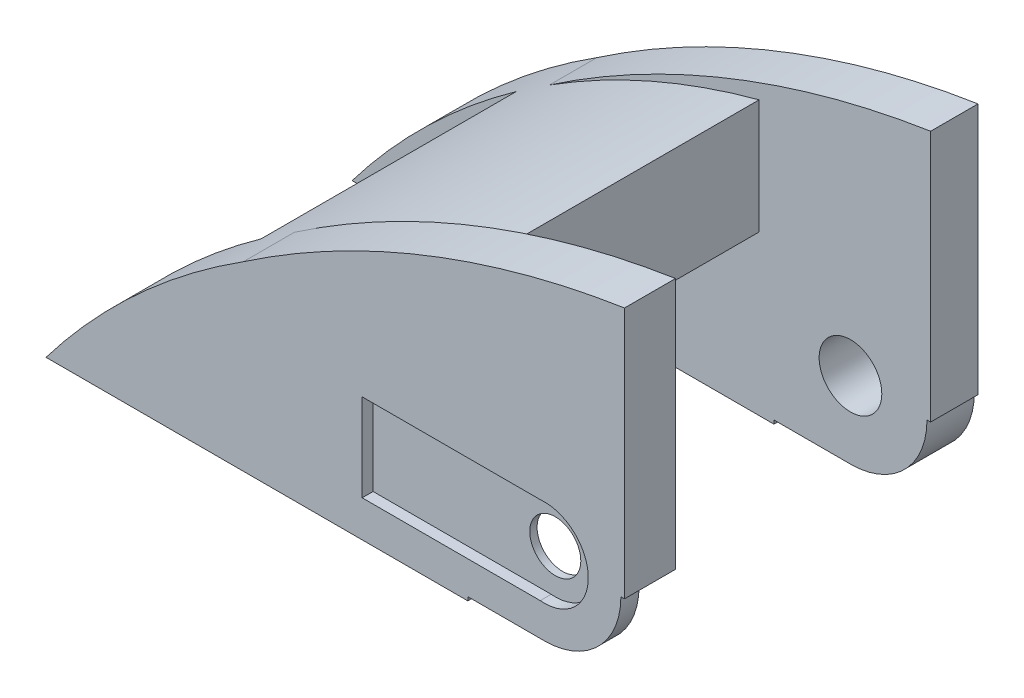
from build123d import *
from build123d.topology import SkipClean

# Parameters (mm, degrees)
SKETCH1_R                 = 9.5
BOSS_EXTRUDE1_DEPTH       = 48
SKETCH2_W                 = 34
SKETCH2_H                 = 30
CUT_EXTRUDE1_DEPTH        = 62.481704596
BOSS_EXTRUDE2_START       = -2.5
SKETCH3_R                 = 9.5
SKETCH3_R_2               = 2.4
BOSS_EXTRUDE2_DEPTH       = 2.5
SKETCH4_R                 = 9.5
SKETCH4_R_2               = 4.2
BOSS_EXTRUDE3_DEPTH       = 7
SKETCH5_R                 = 4.2
BOSS_EXTRUDE4_DEPTH       = 11
BOSS_EXTRUDE5_DEPTH       = 48
CUT_EXTRUDE2_START        = -48
CUT_EXTRUDE2_OUTLINE_R    = 2.65
CUT_EXTRUDE2_DEPTH        = 48
CUT_EXTRUDE3_START        = -4.5
SKETCH8_R                 = 9.5
CUT_EXTRUDE3_DEPTH        = 4.5
SKETCH9_R                 = 6.067807638
CUT_EXTRUDE4_DEPTH        = 4.5
SKETCH10_R                = 9.5
BOSS_EXTRUDE6_DEPTH       = 4.5
SKETCH11_R                = 4.2
BOSS_EXTRUDE7_DEPTH       = 3.5
SKETCH12_R                = 2.4
BOSS_EXTRUDE8_DEPTH       = 2.5
SKETCH13_W                = 35
SKETCH13_H                = 34
CUT_EXTRUDE5_DEPTH        = 14.5
SKETCH15_R                = 3.436413098
BOSS_EXTRUDE9_DEPTH       = 10
BOSS_EXTRUDE10_DEPTH      = 0.5
SKETCH18_R                = 4.2
CUT_EXTRUDE8_DEPTH        = 0.5
CUT_EXTRUDE9_DEPTH        = 69.529190861
BOSS_EXTRUDE11_DEPTH      = 7
CUT_EXTRUDE10_DEPTH       = 99.245865053
BOSS_EXTRUDE12_DEPTH      = 41.5
SKETCH25_R                = 4.2
CUT_EXTRUDE11_DEPTH       = 0.5
CUT_EXTRUDE12_DEPTH       = 99.245865053
BOSS_EXTRUDE13_DEPTH      = 20.5
BOSS_EXTRUDE13_DEPTH_BACK = 20.5
CUT_EXTRUDE14_DEPTH       = 91.289811164
CUT_EXTRUDE15_DEPTH       = 90.647860543
SKETCH31_R                = 2.65
SKETCH31_R_2              = 2.5
BOSS_EXTRUDE14_DEPTH      = 2.5
CUT_EXTRUDE16_DEPTH       = 90.041304074
BOSS_EXTRUDE15_DEPTH      = 7
CUT_EXTRUDE17_DEPTH       = 17.75
CUT_EXTRUDE18_DEPTH       = 21.75
SKETCH38_R                = 4.3
CUT_EXTRUDE20_DEPTH       = 81.365166156
SKETCH39_R                = 3.5
CUT_EXTRUDE21_DEPTH       = 91.679366072
CUT_EXTRUDE22_DEPTH       = 1.5


# Read off the part's stored shape, not the designer's step: Cut-Extrude2
with BuildPart() as part:
    # Sketch1 → Boss-Extrude1 (new body)
    with BuildSketch(Plane.XY):
        with BuildLine():
            Line((-12, 0), (-12, 30))
            Line((-12, 30), (12, 30))
            Line((12, 30), (12, 0))
            ThreePointArc((12, 0), (0, -12), (-12, 0))
        make_face()
        Circle(SKETCH1_R, mode=Mode.SUBTRACT)
    extrude(amount=-BOSS_EXTRUDE1_DEPTH)

    # Sketch2 → Cut-Extrude1 (cut, through all)
    with BuildSketch(Plane.ZY.offset(12)):
        with Locations((-24, 3)):
            Rectangle(SKETCH2_W, SKETCH2_H)
    extrude(amount=-CUT_EXTRUDE1_DEPTH, mode=Mode.SUBTRACT)

    # Sketch3 → Boss-Extrude2 (add)
    with BuildSketch(Plane(origin=(0, 0, -48), x_dir=(-1, 0, 0), z_dir=(0, 0, -1)).offset(BOSS_EXTRUDE2_START)):
        Circle(SKETCH3_R)
        Circle(SKETCH3_R_2, mode=Mode.SUBTRACT)
    extrude(amount=BOSS_EXTRUDE2_DEPTH)

    # Sketch4 → Boss-Extrude3 (add)
    with BuildSketch(Plane.XY):
        with Locations(Location((0, 0, 0), (0, 0, 180))):
            Circle(SKETCH4_R)
        Circle(SKETCH4_R_2, mode=Mode.SUBTRACT)
    extrude(amount=-BOSS_EXTRUDE3_DEPTH)

    # Sketch5 → Boss-Extrude4 (add)
    with BuildSketch(Plane.XY):
        Circle(SKETCH5_R)
    extrude(amount=-BOSS_EXTRUDE4_DEPTH)

    # Sketch6 → Boss-Extrude5 (add)
    with BuildSketch(Plane(origin=(0, 0, -48), x_dir=(-1, 0, 0), z_dir=(0, 0, -1))):
        Polygon((12, 30), (12, 18), (18, 18), (38, 18), (38, 30), align=None)
    extrude(amount=-BOSS_EXTRUDE5_DEPTH)

    # Cut-Extrude2 outline → Cut-Extrude2 (cut)
    with BuildSketch(Plane.XY.offset(CUT_EXTRUDE2_START)):
        Circle(CUT_EXTRUDE2_OUTLINE_R)
    extrude(amount=CUT_EXTRUDE2_DEPTH, mode=Mode.SUBTRACT)

    # Sketch8 → Cut-Extrude3 (cut)
    with BuildSketch(Plane(origin=(0, 0, -7), x_dir=(-1, 0, 0), z_dir=(0, 0, -1)).offset(CUT_EXTRUDE3_START)):
        Circle(SKETCH8_R)
    extrude(amount=CUT_EXTRUDE3_DEPTH, mode=Mode.SUBTRACT)


with BuildPart() as cut_extrude3_piece_1:
    # of the separate pieces the step leaves, piece 1, a body of its own (cut_extrude3_pieces)
    add(part.part.solids().sort_by_distance((-12, 0, 0))[0])

    # Sketch10 → Boss-Extrude6 (add)
    with BuildSketch(Plane.XY.offset(-45.5)):
        with Locations(Location((0, 0, 0), (0, 0, 90))):
            Circle(SKETCH10_R)
    extrude(amount=BOSS_EXTRUDE6_DEPTH)

    # Sketch11 → Boss-Extrude7 (add)
    with BuildSketch(Plane.XY.offset(-41)):
        with Locations(Location((0, 0, 0), (0, 0, 180))):
            Circle(SKETCH11_R)
    extrude(amount=BOSS_EXTRUDE7_DEPTH)

    # Sketch12 → Boss-Extrude8 (add)
    with BuildSketch(Plane(origin=(0, 0, -48), x_dir=(-1, 0, 0), z_dir=(0, 0, -1))):
        Circle(SKETCH12_R)
    extrude(amount=-BOSS_EXTRUDE8_DEPTH)

    # Sketch13 → Cut-Extrude5 (cut)
    with BuildSketch(Plane(origin=(0, 30, 0), x_dir=(1, 0, 0), z_dir=(0, 1, 0))):
        with Locations((-5.5, 24)):
            Rectangle(SKETCH13_W, SKETCH13_H)
    extrude(amount=-CUT_EXTRUDE5_DEPTH, mode=Mode.SUBTRACT)

    # Sketch15 → Boss-Extrude9 (add)
    with BuildSketch(Plane(origin=(0, 0, -48), x_dir=(-1, 0, 0), z_dir=(0, 0, -1))):
        Circle(SKETCH15_R)
    extrude(amount=-BOSS_EXTRUDE9_DEPTH)

    # Sketch16 → Boss-Extrude10 (add)
    with BuildSketch(Plane(origin=(0, 0, -48), x_dir=(-1, 0, 0), z_dir=(0, 0, -1))):
        Polygon((38, 30), (-12, 30), (-12, 18), (12, 18), (38, 18), align=None)
        with BuildLine():
            Line((-12, 0), (12, 0))
            ThreePointArc((12, 0), (0, -12), (-12, 0))
        make_face()
        with BuildLine():
            ThreePointArc((12, 0), (0, 12), (-12, 0))
            Line((-12, 0), (12, 0))
        make_face()
        with BuildLine():
            Line((12, 0), (-12, 0))
            ThreePointArc((-12, 0), (0, -12), (12, 0))
        make_face()
        with BuildLine():
            Line((12, 18), (-12, 18))
            Line((-12, 18), (-12, 0))
            ThreePointArc((-12, 0), (0, 12), (12, 0))
            Line((12, 0), (12, 18))
        make_face()
    extrude(amount=BOSS_EXTRUDE10_DEPTH)

    # Sketch18 → Cut-Extrude8 (cut)
    with SkipClean():  # the faces are left unmerged after this step: merging them gives an invalid solid
        with BuildSketch(Plane.XY.offset(-41)):
            with BuildLine():
                Line((12, 30), (-23, 30))
                Line((-23, 30), (-23, 18))
                Line((-23, 18), (-12, 18))
                Line((-12, 18), (-12, 0))
                ThreePointArc((-12, 0), (0, -12), (12, 0))
                Line((12, 0), (12, 30))
            make_face()
            Circle(SKETCH18_R, mode=Mode.SUBTRACT)
        extrude(amount=-CUT_EXTRUDE8_DEPTH, mode=Mode.SUBTRACT)

    # Sketch19 → Cut-Extrude9 (cut, through all)
    with SkipClean():  # the faces are left unmerged after this step: merging them gives an invalid solid
        with BuildSketch(Plane.XY):
            with BuildLine():
                ThreePointArc((11, 0), (0, -11), (-11, 0))
                Line((-11, 0), (-12, 0))
                ThreePointArc((-12, 0), (0, -12), (12, 0))
                Line((12, 0), (12, 30))
                Line((12, 30), (11, 30))
                Line((11, 30), (11, 0))
            make_face()
        extrude(amount=-CUT_EXTRUDE9_DEPTH, mode=Mode.SUBTRACT)

    # Sketch21 → Boss-Extrude11 (add)
    with SkipClean():  # the faces are left unmerged after this step: merging them gives an invalid solid
        with BuildSketch(Plane.XY):
            with BuildLine():
                Line((-80, -11), (0, -11))
                ThreePointArc((0, -11), (-11, 0), (0, 11))
                Line((0, 11), (0, 29.50098276))
                ThreePointArc((0, 29.50098276), (-43.873330509, 16.901328954), (-80, -11))
            make_face()
        boss_extrude11 = extrude(amount=-BOSS_EXTRUDE11_DEPTH)

    # Mirror2: Boss-Extrude11 across plane
    with SkipClean():  # the faces are left unmerged after this step: merging them gives an invalid solid
        add(boss_extrude11.mirror(Plane.XY.offset(-24.25)))

    # Sketch23 → Cut-Extrude10 (cut, through all)
    with SkipClean():  # the faces are left unmerged after this step: merging them gives an invalid solid
        with BuildSketch(Plane.XY):
            with BuildLine():
                Line((11, 30), (-38, 30))
                Line((-38, 30), (-38, 19.680026504))
                ThreePointArc((-38, 19.680026504), (-14.037481168, 27.392013724), (11, 30))
            make_face()
        extrude(amount=-CUT_EXTRUDE10_DEPTH, mode=Mode.SUBTRACT)

    # Sketch24 → Boss-Extrude12 (add)
    with BuildSketch(Plane.XY):
        with BuildLine():
            ThreePointArc((-23, 25.145323924), (-54.06051883, 11.110516861), (-80, -11))
            Line((-80, -11), (-75.954431576, -11))
            ThreePointArc((-75.954431576, -11), (-51.689916224, 9.05738053), (-23, 22.017084465))
            Line((-23, 22.017084465), (-23, 25.145323924))
        make_face()
    extrude(amount=-BOSS_EXTRUDE12_DEPTH)

    # Sketch25 → Cut-Extrude11 (cut)
    # profile 1 of 4: a face of its own
    with BuildSketch(Plane.XY.offset(-41.5)):
        with BuildLine():
            ThreePointArc((-34.296583622, 18), (-56.696622923, 5.756871838), (-75.954431576, -11))
            Line((-75.954431576, -11), (0, -11))
            ThreePointArc((0, -11), (-7.778174593, 7.778174593), (11, 0))
            Line((11, 0), (11, 27))
            ThreePointArc((11, 27), (-6.181599512, 25.747652826), (-23, 22.017084465))
            Line((-23, 22.017084465), (-23, 18))
            Line((-23, 18), (-34.296583622, 18))
        make_face()
    # profile 2 of 4: a face of its own
    with BuildSketch(Plane.XY.offset(-41.5)):
        with BuildLine():
            ThreePointArc((11, 0), (-7.778174593, 7.778174593), (0, -11))
            ThreePointArc((0, -11), (7.778174593, -7.778174593), (11, 0))
        make_face()
        Circle(SKETCH25_R, mode=Mode.SUBTRACT)
    # profile 3 of 4: a face of its own
    with BuildSketch(Plane.XY.offset(-41.5)):
        with BuildLine():
            Line((-15.831452239, 27), (11, 27))
            Line((11, 27), (11, 30))
            ThreePointArc((11, 30), (-2.499322476, 29.24767055), (-15.831452239, 27))
        make_face()
    # profile 4 of 4: a face of its own
    with BuildSketch(Plane.XY.offset(-41.5)):
        with BuildLine():
            ThreePointArc((-15.831452239, 27), (-19.429859533, 26.127289319), (-23, 25.145323924))
            Line((-23, 25.145323924), (-23, 22.017084465))
            ThreePointArc((-23, 22.017084465), (-6.181599512, 25.747652826), (11, 27))
            Line((11, 27), (-15.831452239, 27))
        make_face()
    extrude(amount=-CUT_EXTRUDE11_DEPTH, mode=Mode.SUBTRACT)

    # Sketch26 → Cut-Extrude12 (cut, through all)
    with BuildSketch(Plane.XY):
        with BuildLine():
            Line((-289.619638312, -11), (-80, -11))
            Line((-80, -11), (-70, -11))
            ThreePointArc((-70, -11), (-34.238011767, 18.860462272), (11, 30))
            Line((11, 30), (220.598190616, 32.998542465))
            Line((220.598190616, 32.998542465), (184.578847054, 450.687634918))
            Line((184.578847054, 450.687634918), (-325.638981874, 406.689092453))
            Line((-325.638981874, 406.689092453), (-289.619638312, -11))
        make_face()
    extrude(amount=-CUT_EXTRUDE12_DEPTH, mode=Mode.SUBTRACT)

    # Sketch27 → Boss-Extrude13 (add, two sides: drawn at the far end of the back side and taken through both)
    with SkipClean():  # the faces are left unmerged after this step: merging them gives an invalid solid
        with BuildSketch(Plane.XY.offset(-24.25).offset(-BOSS_EXTRUDE13_DEPTH_BACK)):
            with BuildLine():
                Line((-47.531279655, 10.824644679), (-12.531279655, 10.824644679))
                Line((-12.531279655, 10.824644679), (-12.531279655, 26.941493444))
                ThreePointArc((-12.531279655, 26.941493444), (-30.78831932, 20.527086985), (-47.531279655, 10.824644679))
            make_face()
        extrude(amount=BOSS_EXTRUDE13_DEPTH + BOSS_EXTRUDE13_DEPTH_BACK)

    # Sketch28 → Cut-Extrude14 (cut, through all)
    with BuildSketch(Plane.XY):
        with BuildLine():
            ThreePointArc((11, 30), (-34.238011767, 18.860462272), (-70, -11))
            Line((-70, -11), (-69.17, -11))
            ThreePointArc((-69.17, -11), (-33.867981255, 18.852478225), (11, 30))
        make_face()
    extrude(amount=-CUT_EXTRUDE14_DEPTH, mode=Mode.SUBTRACT)

    # Sketch30 → Cut-Extrude15 (cut, through all)
    with BuildSketch(Plane.XY):
        with BuildLine():
            Line((-69.17, -11), (-68.382043193, -11))
            ThreePointArc((-68.382043193, -11), (-33.329298575, 18.480387889), (11, 30))
            ThreePointArc((11, 30), (-33.867981255, 18.852478225), (-69.17, -11))
        make_face()
    extrude(amount=-CUT_EXTRUDE15_DEPTH, mode=Mode.SUBTRACT)

    # Sketch31 → Boss-Extrude14 (add)
    with BuildSketch(Plane.XY):
        Circle(SKETCH31_R)
        Circle(SKETCH31_R_2, mode=Mode.SUBTRACT)
    extrude(amount=-BOSS_EXTRUDE14_DEPTH)

    # Sketch32 → Cut-Extrude16 (cut, through all)
    with BuildSketch(Plane.XY):
        with BuildLine():
            Line((0, -10.5), (-10.5, -10.5))
            Line((-10.5, -10.5), (-10.5, -11))
            Line((-10.5, -11), (0, -11))
            ThreePointArc((0, -11), (7.778174593, -7.778174593), (11, 0))
            Line((11, 0), (10.5, 0))
            ThreePointArc((10.5, 0), (7.424621202, -7.424621202), (0, -10.5))
        make_face()
    extrude(amount=-CUT_EXTRUDE16_DEPTH, mode=Mode.SUBTRACT)

    # Sketch33 → Boss-Extrude15 (add)
    with BuildSketch(Plane.XY):
        with BuildLine():
            Line((11, 30), (11, 34.56))
            ThreePointArc((11, 34.56), (-16.306713668, 27.153418453), (-41.30515803, 13.902311291))
            ThreePointArc((-41.30515803, 13.902311291), (-16.232852944, 25.461218463), (11, 30))
        make_face()
    boss_extrude15 = extrude(amount=-BOSS_EXTRUDE15_DEPTH)

    # Mirror3: Boss-Extrude15 across plane
    add(boss_extrude15.mirror(Plane.XY.offset(-24.25)))

    # Sketch34 → Cut-Extrude17 (cut)
    with BuildSketch(Plane.XY.offset(-24.25)):
        with BuildLine():
            Line((11, 30), (11, 34.56))
            ThreePointArc((11, 34.56), (-16.306713668, 27.153418453), (-41.30515803, 13.902311291))
            ThreePointArc((-41.30515803, 13.902311291), (-27.398755364, 21.309324072), (-12.531279655, 26.525648402))
            ThreePointArc((-12.531279655, 26.525648402), (-0.865514718, 28.939262351), (11, 30))
        make_face()
    extrude(amount=-CUT_EXTRUDE17_DEPTH, mode=Mode.SUBTRACT)

    # Sketch37 → Cut-Extrude18 (cut)
    with BuildSketch(Plane.XY.offset(-24.25)):
        with BuildLine():
            Line((-10.5, 0), (-10.5, -10.5))
            Line((-10.5, -10.5), (0, -10.5))
            ThreePointArc((0, -10.5), (7.424621202, -7.424621202), (10.5, 0))
            Line((10.5, 0), (9.5, 0))
            ThreePointArc((9.5, 0), (0, -9.5), (-9.5, 0))
            Line((-9.5, 0), (-10.5, 0))
        make_face()
        with BuildLine():
            ThreePointArc((10.5, 0), (7.424621202, -7.424621202), (0, -10.5))
            Line((0, -10.5), (11, -10.5))
            Line((11, -10.5), (11, 0))
            Line((11, 0), (10.5, 0))
        make_face()
    extrude(amount=CUT_EXTRUDE18_DEPTH, mode=Mode.SUBTRACT)

    # Sketch38 → Cut-Extrude20 (cut, through all)
    with BuildSketch(Plane.XY.offset(-24.25)):
        Circle(SKETCH38_R)
    extrude(amount=-CUT_EXTRUDE20_DEPTH, mode=Mode.SUBTRACT)

    # Sketch39 → Cut-Extrude21 (cut, through all)
    with BuildSketch(Plane.XY):
        Circle(SKETCH39_R)
    extrude(amount=-CUT_EXTRUDE21_DEPTH, mode=Mode.SUBTRACT)

    # Sketch40 → Cut-Extrude22 (cut)
    with BuildSketch(Plane.XY):
        with BuildLine():
            ThreePointArc((-0.563204585, -6), (-6.026375312, 0), (-0.563204585, 6))
            Line((-0.563204585, 6), (-25, 6))
            Line((-25, 6), (-25, -6))
            Line((-25, -6), (-0.563204585, -6))
        make_face()
        with BuildLine():
            Line((0, 3.5), (0, 6))
            Line((0, 6), (-0.563204585, 6))
            ThreePointArc((-0.563204585, 6), (-6.026375312, 0), (-0.563204585, -6))
            Line((-0.563204585, -6), (0, -6))
            Line((0, -6), (0, -3.5))
            ThreePointArc((0, -3.5), (-3.5, 0), (0, 3.5))
        make_face()
        with BuildLine():
            Line((-0.563204585, 6), (0, 6))
            Line((0, 6), (0, 3.5))
            ThreePointArc((0, 3.5), (2.474873734, 2.474873734), (3.5, 0))
            ThreePointArc((3.5, 0), (2.474873734, -2.474873734), (0, -3.5))
            Line((0, -3.5), (0, -6))
            Line((0, -6), (-0.563204585, -6))
            ThreePointArc((-0.563204585, -6), (4.057284634, -4.455966877), (6.026375312, 0))
            ThreePointArc((6.026375312, 0), (4.057284634, 4.455966877), (-0.563204585, 6))
        make_face()
    extrude(amount=-CUT_EXTRUDE22_DEPTH, mode=Mode.SUBTRACT)


with BuildPart() as cut_extrude3_piece_2:
    # of the separate pieces the step leaves, piece 2, a body of its own (cut_extrude3_pieces)
    add(part.part.solids().sort_by_distance((4.2, 0, -7))[0])

    # Sketch9 → Cut-Extrude4 (cut)
    with BuildSketch(Plane(origin=(0, 0, -11), x_dir=(-1, 0, 0), z_dir=(0, 0, -1))):
        Circle(SKETCH9_R)
    extrude(amount=-CUT_EXTRUDE4_DEPTH, mode=Mode.SUBTRACT)


solid = cut_extrude3_piece_1.part
